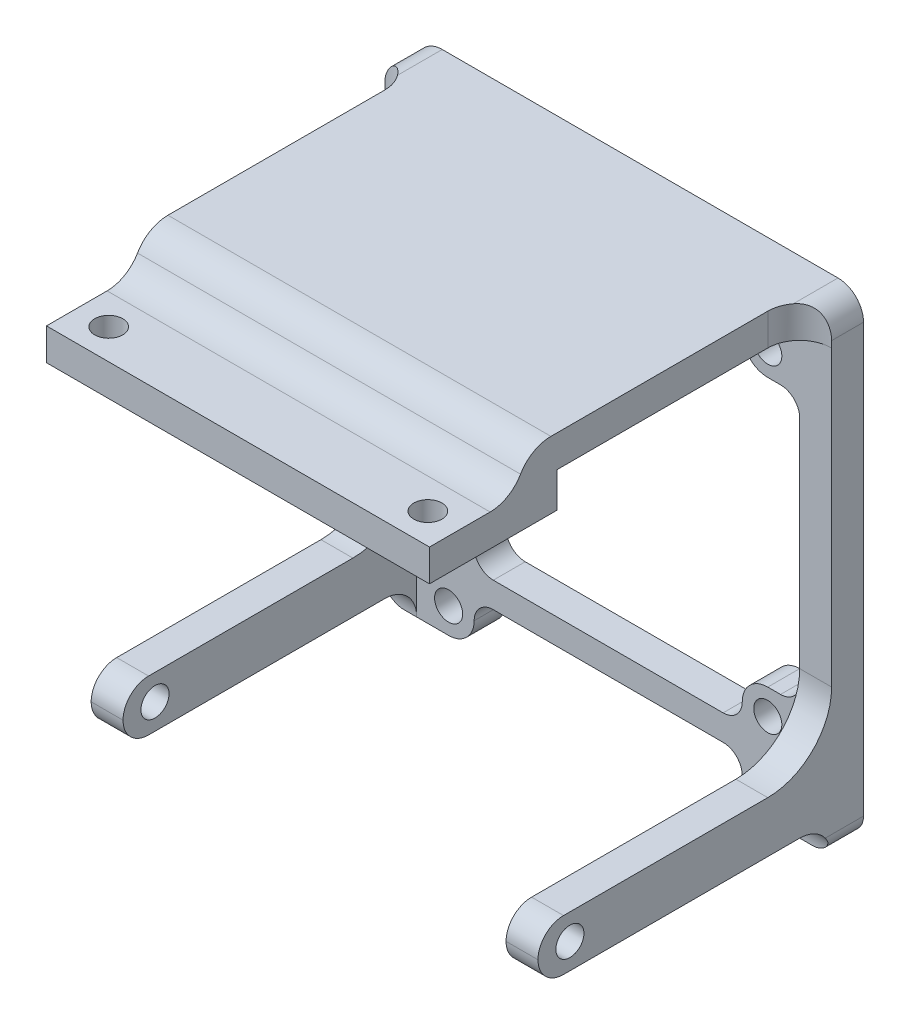
from build123d import *

# Parameters (mm, degrees)
SKETCH1_R           = 2.2
BOSS_EXTRUDE1_DEPTH = 5
FILLET1_R           = 3
FILLET2_R           = 3
SKETCH2_W           = 70
SKETCH2_H           = 43
BOSS_EXTRUDE2_DEPTH = 5
SKETCH3_W           = 70
SKETCH3_H           = 10.5
BOSS_EXTRUDE3_DEPTH = 5
SKETCH4_W           = 70
SKETCH4_H           = 5
BOSS_EXTRUDE4_DEPTH = 15
FILLET3_R           = 5.5
SKETCH6_W           = 5
SKETCH6_H           = 58
CUT_EXTRUDE1_DEPTH  = 15
FILLET4_R           = 5.5
FILLET5_R           = 5
SKETCH7_R           = 2.2
CUT_EXTRUDE2_DEPTH  = 15
SKETCH8_W           = 5
SKETCH8_H           = 8
BOSS_EXTRUDE5_DEPTH = 46
FILLET7_R           = 10
FILLET8_R           = 3
FILLET9_R           = 5
SKETCH10_R          = 2.2
CUT_EXTRUDE3_DEPTH  = 178.791001057
FILLET10_R          = 4
FILLET11_R          = 4
FILLET12_R          = 4


# Some blends are built 0.0001 mm under size
with BuildPart() as part:
    # Sketch1 → Boss-Extrude1 (new body)
    with BuildSketch(Plane.XY):
        with BuildLine():
            Line((-45.5, 87.8), (-45.5, 90.8))
            ThreePointArc((-45.5, 90.8), (-44.328427125, 93.628427125), (-41.5, 94.8))
            Line((-41.5, 94.8), (-36.5, 94.8))
            Line((-36.5, 94.8), (-36.5, 136.8))
            Line((-36.5, 136.8), (-41.5, 136.8))
            ThreePointArc((-41.5, 136.8), (-44.328427125, 137.971572875), (-45.5, 140.8))
            Line((-45.5, 140.8), (-45.5, 145.8))
            Line((-45.5, 145.8), (-36.5, 145.8))
            Line((-36.5, 145.8), (-31.5, 145.8))
            Line((-31.5, 145.8), (-31.5, 76.8))
            Line((-31.5, 76.8), (-36.5, 76.8))
            Line((-36.5, 76.8), (-41.5, 76.8))
            ThreePointArc((-41.5, 76.8), (-44.328427125, 77.971572875), (-45.5, 80.8))
            Line((-45.5, 80.8), (-45.5, 83.8))
            Line((-45.5, 83.8), (-87.5, 83.8))
            Line((-87.5, 83.8), (-87.5, 80.8))
            ThreePointArc((-87.5, 80.8), (-88.671572875, 77.971572875), (-91.5, 76.8))
            Line((-91.5, 76.8), (-96.5, 76.8))
            Line((-96.5, 76.8), (-101.5, 76.8))
            Line((-101.5, 76.8), (-101.5, 145.8))
            Line((-101.5, 145.8), (-96.5, 145.8))
            Line((-96.5, 145.8), (-87.5, 145.8))
            Line((-87.5, 145.8), (-87.5, 140.8))
            ThreePointArc((-87.5, 140.8), (-88.671572875, 137.971572875), (-91.5, 136.8))
            Line((-91.5, 136.8), (-96.5, 136.8))
            Line((-96.5, 136.8), (-96.5, 94.8))
            Line((-96.5, 94.8), (-91.5, 94.8))
            ThreePointArc((-91.5, 94.8), (-88.671572875, 93.628427125), (-87.5, 90.8))
            Line((-87.5, 90.8), (-87.5, 87.8))
            Line((-87.5, 87.8), (-45.5, 87.8))
        make_face()
        with Locations((-91.5, 140.8)):
            Circle(SKETCH1_R, mode=Mode.SUBTRACT)
        with Locations(Location((-41.5, 140.8, 0), (0, 0, 180))):
            Circle(SKETCH1_R, mode=Mode.SUBTRACT)
        with Locations((-41.5, 90.8)):
            Circle(SKETCH1_R, mode=Mode.SUBTRACT)
        with Locations(Location((-91.5, 90.8, 0), (0, 0, 180))):
            Circle(SKETCH1_R, mode=Mode.SUBTRACT)
        with Locations((-91.5, 80.8)):
            Circle(SKETCH1_R, mode=Mode.SUBTRACT)
        with Locations(Location((-41.5, 80.8, 0), (0, 0, 180))):
            Circle(SKETCH1_R, mode=Mode.SUBTRACT)
    extrude(amount=BOSS_EXTRUDE1_DEPTH)

    # Fillet1
    fillet1_edges = [part.edges().sort_by_distance(p)[0] for p in [
        (-36.5, 136.8, 2.5),
        (-96.5, 136.8, 2.5),
        (-36.5, 94.8, 2.5),
        (-45.5, 87.8, 2.5),
        (-45.5, 83.8, 2.5),
        (-87.5, 83.8, 2.5),
        (-87.5, 87.8, 2.5),
        (-96.5, 94.8, 2.5),
    ]]
    fillet(fillet1_edges, radius=FILLET1_R - 0.0001)  # a hair under: the kernel refuses the full size

    # Fillet2
    fillet2_edges = [part.edges().sort_by_distance(p)[0] for p in [
        (-31.5, 76.8, 2.5),
        (-101.5, 76.8, 2.5),
    ]]
    fillet(fillet2_edges, radius=FILLET2_R)

    # Sketch2 → Boss-Extrude2 (add)
    with BuildSketch(Plane(origin=(0, 145.8, 0), x_dir=(1, 0, 0), z_dir=(0, 1, 0))):
        with Locations((-66.5, -21.5)):
            Rectangle(SKETCH2_W, SKETCH2_H)
    extrude(amount=BOSS_EXTRUDE2_DEPTH)

    # Sketch3 → Boss-Extrude3 (add)
    with BuildSketch(Plane.XY.offset(43)):
        with Locations((-66.5, 145.55)):
            Rectangle(SKETCH3_W, SKETCH3_H)
    extrude(amount=BOSS_EXTRUDE3_DEPTH)

    # Sketch4 → Boss-Extrude4 (add)
    with BuildSketch(Plane.XY.offset(48)):
        with Locations((-66.5, 142.8)):
            Rectangle(SKETCH4_W, SKETCH4_H)
    extrude(amount=BOSS_EXTRUDE4_DEPTH)

    # Fillet3
    fillet3_edges = [part.edges().sort_by_distance(p)[0] for p in [
        (-66.5, 145.3, 48),
    ]]
    fillet(fillet3_edges, radius=FILLET3_R - 0.0001)  # a hair under: the kernel refuses the full size

    # Sketch6 → Cut-Extrude1 (cut)
    with BuildSketch(Plane(origin=(0, 150.8, 0), x_dir=(1, 0, 0), z_dir=(0, 1, 0))):
        with Locations((-99, -34)):
            Rectangle(SKETCH6_W, SKETCH6_H)
        with Locations((-34, -34)):
            Rectangle(SKETCH6_W, SKETCH6_H)
    extrude(amount=-CUT_EXTRUDE1_DEPTH, mode=Mode.SUBTRACT)

    # Fillet4
    fillet4_edges = [part.edges().sort_by_distance(p)[0] for p in [
        (-66.5, 150.8, 48),
    ]]
    fillet(fillet4_edges, radius=FILLET4_R)

    # Fillet5
    fillet5_edges = [part.edges().sort_by_distance(p)[0] for p in [
        (-36.5, 148.3, 5),
        (-96.5, 148.3, 5),
    ]]
    fillet(fillet5_edges, radius=FILLET5_R - 0.0001)  # a hair under: the kernel refuses the full size

    # Sketch7 → Cut-Extrude2 (cut)
    with BuildSketch(Plane(origin=(0, 145.3, 0), x_dir=(1, 0, 0), z_dir=(0, 1, 0))):
        with Locations(Location((-91.5, -58.25, 0), (0, 0, 270))):
            Circle(SKETCH7_R)
        with Locations(Location((-41.5, -58.25, 0), (0, 0, 270))):
            Circle(SKETCH7_R)
    extrude(amount=-CUT_EXTRUDE2_DEPTH, mode=Mode.SUBTRACT)

    # Sketch8 → Boss-Extrude5 (add)
    with BuildSketch(Plane.XY.offset(5)):
        with Locations((-99, 85.8)):
            Rectangle(SKETCH8_W, SKETCH8_H)
        with Locations((-34, 85.8)):
            Rectangle(SKETCH8_W, SKETCH8_H)
    extrude(amount=BOSS_EXTRUDE5_DEPTH)

    # Fillet7
    # the kernel refuses this fillet: 10 mm, written as the material it adds along each edge
    with BuildSketch(Plane(origin=(-101.5, 89.8, 5), x_dir=(0, 1, 0), z_dir=(1, 0, 0))) as fillet7_piece_1:
        with BuildLine():
            CenterArc((FILLET7_R, FILLET7_R), FILLET7_R, 180, 90)
            Line((0, FILLET7_R), (0, 0))
            Line((0, 0), (FILLET7_R, 0))
        make_face()
    extrude(amount=5)
    with BuildSketch(Plane(origin=(-31.5, 89.8, 5), x_dir=(0, 1, 0), z_dir=(-1, 0, 0))) as fillet7_piece_2:
        with BuildLine():
            CenterArc((FILLET7_R, -FILLET7_R), FILLET7_R, 90, 90)
            Line((0, -FILLET7_R), (0, 0))
            Line((0, 0), (FILLET7_R, 0))
        make_face()
    extrude(amount=5)

    # Fillet8
    fillet8_edges = [part.edges().sort_by_distance(p)[0] for p in [
        (-87.5, 145.8, 2.5),
        (-45.5, 145.8, 2.5),
    ]]
    fillet(fillet8_edges, radius=FILLET8_R)

    # Fillet9
    fillet9_edges = [part.edges().sort_by_distance(p)[0] for p in [
        (-34, 81.8, 5),
        (-99, 81.8, 5),
    ]]
    fillet(fillet9_edges, radius=FILLET9_R - 0.0001)  # a hair under: the kernel refuses the full size

    # Sketch10 → Cut-Extrude3 (cut, through all)
    with BuildSketch(Plane.ZY.offset(101.5)):
        with Locations((46, 85.8)):
            Circle(SKETCH10_R)
    extrude(amount=-CUT_EXTRUDE3_DEPTH, mode=Mode.SUBTRACT)

    # Fillet10
    fillet10_edges = [part.edges().sort_by_distance(p)[0] for p in [
        (-99, 81.8, 51),
        (-99, 89.8, 51),
        (-34, 81.8, 51),
        (-34, 89.8, 51),
    ]]
    fillet(fillet10_edges, radius=FILLET10_R - 0.0001)  # a hair under: the kernel refuses the full size

    # Fillet11
    fillet11_edges = [part.edges().sort_by_distance(p)[0] for p in [
        (-101.5, 150.8, 2.5),
    ]]
    fillet(fillet11_edges, radius=FILLET11_R)

    # Fillet12
    fillet12_edges = [part.edges().sort_by_distance(p)[0] for p in [
        (-31.5, 150.8, 2.5),
    ]]
    fillet(fillet12_edges, radius=FILLET12_R)


solid = part.part
